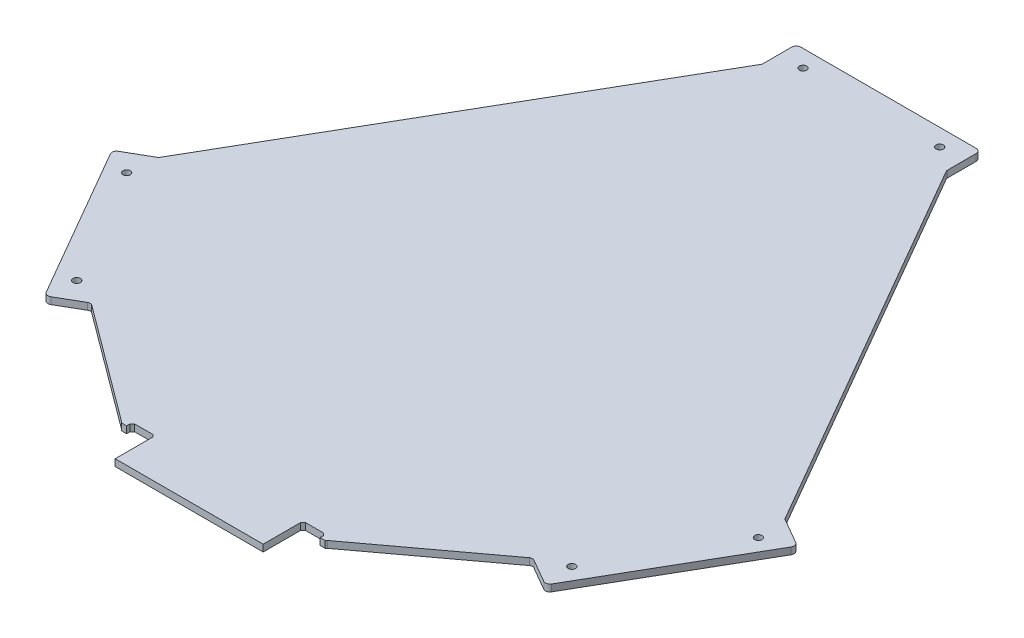
from build123d import *

# Parameters (mm, degrees)
SKETCH_1_R      = 1.6
EXTRUDE_1_DEPTH = 1.5
FILLET_1_R      = 2
EXTRUDE_2_DEPTH = 1.5


with BuildPart() as part:
    # ｽｹｯﾁ1 → ﾎﾞｽ - 押し出し1 (new, symmetric)
    with BuildSketch(Plane(origin=(0, 0, 0), x_dir=(1, 0, 0), z_dir=(0, 1, 0))):
        Polygon((137.509839672, -32.625971147), (40.5, 135.4), (40.5, 150.4), (-40.5, 150.4), (-40.5, 136.549246059), (-40.5, 135.4), (-137.509839672, -32.625971147), (-150.500220729, -40.125971147), (-110.000220729, -110.274028853), (-97.009839672, -102.774028853), (97.009839672, -102.774028853), (110.000220729, -110.274028853), (150.500220729, -40.125971147), align=None)
        with Locations((138.755030201, -45.469237886)):
            Circle(SKETCH_1_R, mode=Mode.SUBTRACT)
        with Locations((108.755030201, -97.430762114)):
            Circle(SKETCH_1_R, mode=Mode.SUBTRACT)
        with Locations((-138.755030201, -45.469237886)):
            Circle(SKETCH_1_R, mode=Mode.SUBTRACT)
        with Locations((-108.755030201, -97.430762114)):
            Circle(SKETCH_1_R, mode=Mode.SUBTRACT)
        with Locations((30, 142.9)):
            Circle(SKETCH_1_R, mode=Mode.SUBTRACT)
        with Locations((-30, 142.9)):
            Circle(SKETCH_1_R, mode=Mode.SUBTRACT)
    extrude(amount=EXTRUDE_1_DEPTH, both=True)

    # ﾌｨﾚｯﾄ1
    fillet_1_edges = [part.edges().sort_by_distance(p)[0] for p in [
        (-97.009839672, 0, 102.774028853),
        (-150.500220729, 0, 40.125971147),
        (-137.509839672, 0, 32.625971147),
        (-40.5, 0, -135.4),
        (-40.5, 0, -150.4),
        (40.5, 0, -150.4),
        (40.5, 0, -135.4),
        (137.509839672, 0, 32.625971147),
        (150.500220729, 0, 40.125971147),
        (110.000220729, 0, 110.274028853),
        (97.009839672, 0, 102.774028853),
        (-110.000220729, 0, 110.274028853),
    ]]
    fillet(fillet_1_edges, radius=FILLET_1_R)

    # ｽｹｯﾁ4 → ﾎﾞｽ - 押し出し2 (add, symmetric)
    with BuildSketch(Plane(origin=(0, 0, 0), x_dir=(1, 0, 0), z_dir=(0, 1, 0))):
        with BuildLine():
            ThreePointArc((96.087046724, -103.45902497), (97.029580533, -103.117086547), (98.005115955, -103.348651883))
            Line((98.005115955, -103.348651883), (97.473941288, -103.041978046))
            ThreePointArc((97.473941288, -103.041978046), (96.991579378, -102.842177201), (96.473941288, -102.774028853))
            Line((96.473941288, -102.774028853), (-96.473941288, -102.774028853))
            ThreePointArc((-96.473941288, -102.774028853), (-96.991579378, -102.842177201), (-97.473941288, -103.041978046))
            Line((-97.473941288, -103.041978046), (-98.005115955, -103.348651883))
            ThreePointArc((-98.005115955, -103.348651883), (-97.029580533, -103.117086547), (-96.087046724, -103.45902497))
            Line((-96.087046724, -103.45902497), (-45.216770441, -141.22041202))
            ThreePointArc((-45.216770441, -141.22041202), (-44.955440065, -141.458946486), (-44.747432377, -141.745172024))
            Line((-44.747432377, -141.745172024), (-42.499839612, -141.745172024))
            Line((-42.499839612, -141.745172024), (-42.4998396, -140.250171382))
            Line((-42.4998396, -140.250171382), (-41.499839592, -139.25017139))
            Line((-41.499839592, -139.25017139), (-33.499839592, -139.250171454))
            Line((-33.499839592, -139.250171454), (-32.4998396, -140.250171462))
            Line((-32.4998396, -140.250171462), (-32.499839612, -141.745172024))
            Line((-32.499839612, -141.745172024), (-32.499839612, -141.750171462))
            Line((-32.499839612, -141.750171462), (-32.499839733, -156.745172024))
            Line((-32.499839733, -156.745172024), (32.500160267, -156.745172024))
            Line((32.500160267, -156.745172024), (32.5001604, -140.245171983))
            Line((32.5001604, -140.245171983), (33.500160408, -139.245171991))
            Line((33.500160408, -139.245171991), (41.500160408, -139.245172056))
            Line((41.500160408, -139.245172056), (42.5001604, -140.245172064))
            Line((42.5001604, -140.245172064), (42.500160388, -141.745172064))
            Line((42.500160388, -141.745172024), (44.747432377, -141.745172024))
            ThreePointArc((44.747432377, -141.745172024), (44.955440065, -141.458946486), (45.216770441, -141.22041202))
            Line((45.216770441, -141.22041202), (96.087046724, -103.45902497))
        make_face()
    extrude(amount=EXTRUDE_2_DEPTH, both=True)


solid = part.part
